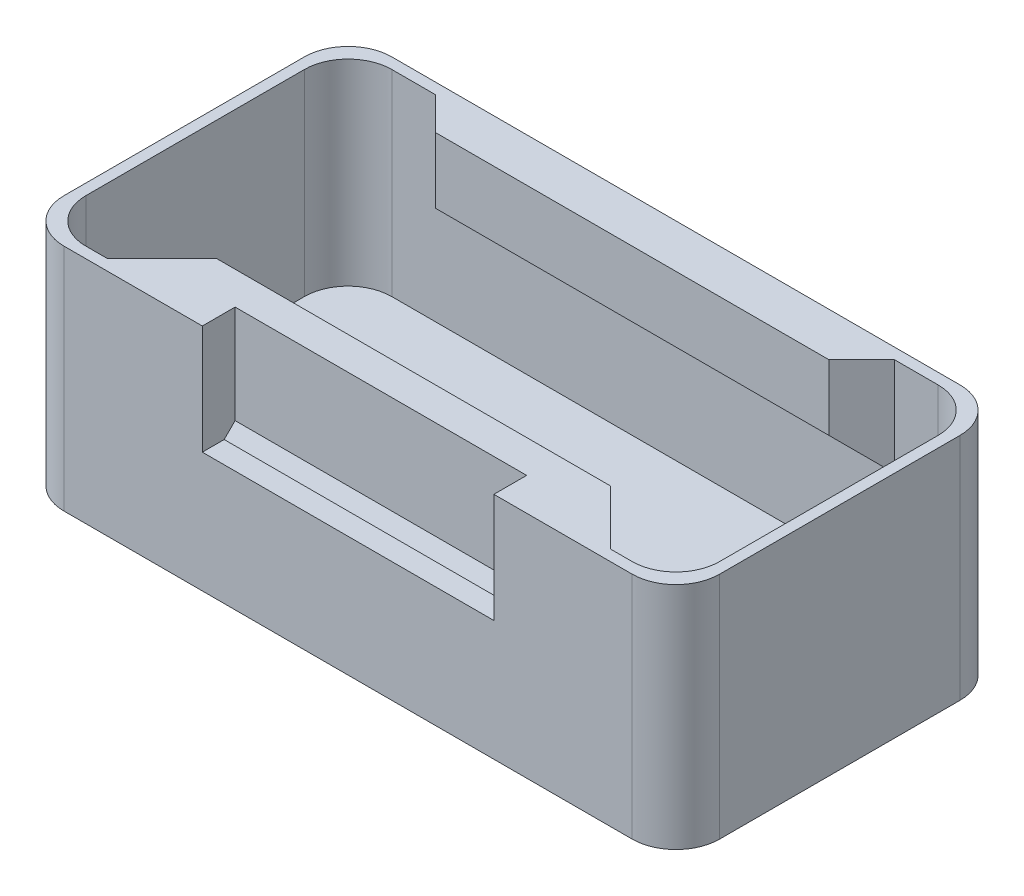
from build123d import *

# Parameters (mm, degrees)
SKETCH1_W           = 300
SKETCH1_H           = 150
BOSS_EXTRUDE1_DEPTH = 5
SKETCH3_W           = 300
SKETCH3_H           = 150
SKETCH3_W_2         = 290
SKETCH3_H_2         = 140
BOSS_EXTRUDE2_DEPTH = 100
SKETCH4_W           = 290
SKETCH4_H           = 50
SKETCH4_H_2         = 60
BOSS_EXTRUDE3_DEPTH = 10
SKETCH7_R           = 12
CUT_EXTRUDE1_DEPTH  = 351
FILLET1_R           = 20
SKETCH10_W          = 180
SKETCH10_H          = 30
BOSS_EXTRUDE4_DEPTH = 15
SKETCH11_W          = 180
SKETCH11_H          = 30
BOSS_EXTRUDE5_DEPTH = 25
CHAMFER2_SIZE       = 15
CHAMFER3_SIZE       = 25
SKETCH12_W          = 133.404446906
SKETCH12_H          = 15
CUT_EXTRUDE2_DEPTH  = 50


with BuildPart() as part:
    # Sketch1 → Boss-Extrude1 (new body)
    with BuildSketch(Plane(origin=(0, 0, 0), x_dir=(1, 0, 0), z_dir=(0, 1, 0))):
        with Locations((150, 75)):
            Rectangle(SKETCH1_W, SKETCH1_H)
    extrude(amount=BOSS_EXTRUDE1_DEPTH)

    # Sketch3 → Boss-Extrude2 (add)
    with BuildSketch(Plane(origin=(0, 5, 0), x_dir=(1, 0, 0), z_dir=(0, 1, 0))):
        with Locations((150, 75)):
            Rectangle(SKETCH3_W, SKETCH3_H)
        with Locations((150, 75)):
            Rectangle(SKETCH3_W_2, SKETCH3_H_2, mode=Mode.SUBTRACT)
    extrude(amount=BOSS_EXTRUDE2_DEPTH)

    # Sketch4 → Boss-Extrude3 (add)
    with BuildSketch(Plane(origin=(0, 5, 0), x_dir=(1, 0, 0), z_dir=(0, 1, 0))):
        with Locations((150, 120)):
            Rectangle(SKETCH4_W, SKETCH4_H)
        with Locations((150, 35)):
            Rectangle(SKETCH4_W, SKETCH4_H_2)
    extrude(amount=BOSS_EXTRUDE3_DEPTH)

    # Sketch7 → Cut-Extrude1 (cut, through all)
    with BuildSketch(Plane(origin=(0, 5, 0), x_dir=(1, 0, 0), z_dir=(0, 1, 0))):
        with Locations(Location((150, 80, 0), (0, 0, 270))):
            Circle(SKETCH7_R)
    extrude(amount=-CUT_EXTRUDE1_DEPTH, mode=Mode.SUBTRACT)

    # Fillet1
    fillet1_edges = [part.edges().sort_by_distance(p)[0] for p in [
        (5, 60, -145),
        (5, 60, -5),
        (295, 60, -5),
        (295, 60, -145),
        (0, 52.5, -150),
        (300, 52.5, -150),
        (300, 52.5, 0),
        (0, 52.5, 0),
    ]]
    fillet(fillet1_edges, radius=FILLET1_R)

    # Sketch10 → Boss-Extrude4 (add)
    with BuildSketch(Plane.XY.offset(-145)):
        with Locations((150, 90)):
            Rectangle(SKETCH10_W, SKETCH10_H)
    extrude(amount=BOSS_EXTRUDE4_DEPTH)

    # Sketch11 → Boss-Extrude5 (add)
    with BuildSketch(Plane(origin=(0, 0, -5), x_dir=(-1, 0, 0), z_dir=(0, 0, -1))):
        with Locations((-150, 90)):
            Rectangle(SKETCH11_W, SKETCH11_H)
    extrude(amount=BOSS_EXTRUDE5_DEPTH)

    # Chamfer2
    chamfer2_edges = [part.edges().sort_by_distance(p)[0] for p in [
        (240, 90, -145),
        (150, 75, -145),
        (60, 90, -145),
    ]]
    chamfer(chamfer2_edges, length=CHAMFER2_SIZE - 0.0001)  # a hair under: the kernel refuses the full size

    # Chamfer3
    chamfer3_edges = [part.edges().sort_by_distance(p)[0] for p in [
        (60, 90, -5),
        (150, 75, -5),
        (240, 90, -5),
    ]]
    chamfer(chamfer3_edges, length=CHAMFER3_SIZE - 0.0001)  # a hair under: the kernel refuses the full size

    # Sketch12 → Cut-Extrude2 (cut)
    with BuildSketch(Plane(origin=(0, 105, 0), x_dir=(1, 0, 0), z_dir=(0, 1, 0))):
        with Locations((150, 7.5)):
            Rectangle(SKETCH12_W, SKETCH12_H)
    extrude(amount=-CUT_EXTRUDE2_DEPTH, mode=Mode.SUBTRACT)


solid = part.part
